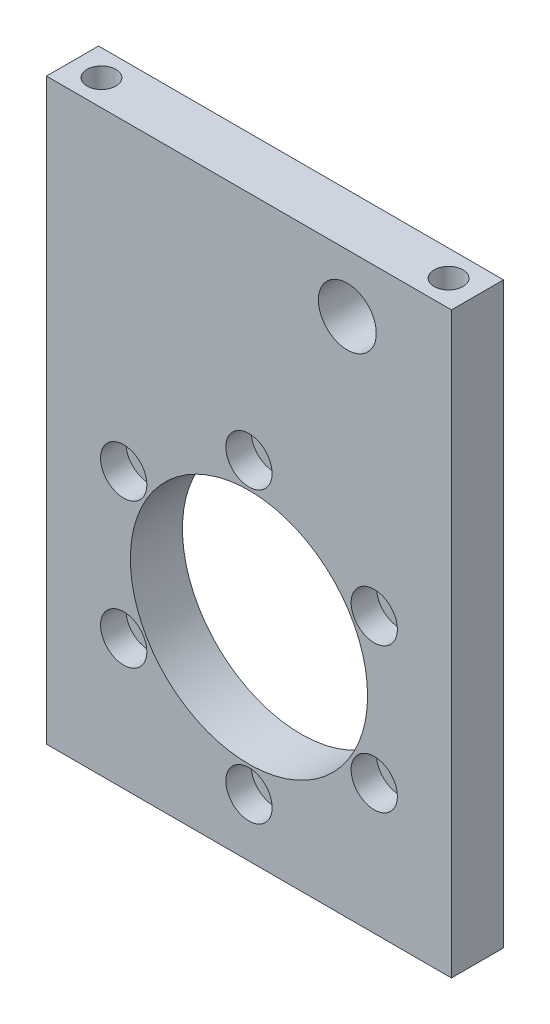
from build123d import *

# Parameters (mm, degrees)
SKETCH1_W                                           = 70
SKETCH1_H                                           = 100
BOSS_EXTRUDE1_DEPTH                                 = 4.5
CUT_EXTRUDE2_DEPTH                                  = 123.148475226
CUT_EXTRUDE2_DEPTH_BACK                             = 123.148475226
SKETCH3_R                                           = 20.5
M6_TAPPED_HOLE1_AT_2_COUNT                          = 2
M6_TAPPED_HOLE1_AT_2_PITCH                          = 60
CBORE_FOR_M4_HEX_SOCKET_HEAD_CAP_SCREW1_D           = 4.3
CBORE_FOR_M4_HEX_SOCKET_HEAD_CAP_SCREW1_CBORE_D     = 8
CBORE_FOR_M4_HEX_SOCKET_HEAD_CAP_SCREW1_CBORE_DEPTH = 4.4
CIRPATTERN1_COUNT                                   = 6
SKETCH8_R                                           = 5
CUT_EXTRUDE3_DEPTH                                  = 10


with BuildPart() as part:
    # Sketch1 → Boss-Extrude1 (new, symmetric)
    with BuildSketch(Plane.XY):
        with Locations((35, 50)):
            Rectangle(SKETCH1_W, SKETCH1_H)
    extrude(amount=BOSS_EXTRUDE1_DEPTH, both=True)

    # Sketch3 → Cut-Extrude2 (cut, two sides: drawn at the far end of the back side and taken through both)
    with BuildSketch(Plane.XY.offset(-CUT_EXTRUDE2_DEPTH_BACK)):
        with Locations((35, 35)):
            Circle(SKETCH3_R)
    extrude(amount=CUT_EXTRUDE2_DEPTH + CUT_EXTRUDE2_DEPTH_BACK, mode=Mode.SUBTRACT)

    # Sketch5 → M6 Tapped Hole1 (revolve, cut)
    with BuildSketch(Plane(origin=(65, 0, 0), x_dir=(0, 0, -1), z_dir=(1, 0, 0))):
        Polygon((0, 0), (0, 16.502151548), (2.5, 15), (2.5, 0), align=None)
    m6_tapped_hole1 = revolve(axis=Axis((65, -6.35, 0), (0, 1, 0)), mode=Mode.SUBTRACT)

    # M6 Tapped Hole1 at 2: M6 Tapped Hole1 ×2
    with Locations(*[(-i * M6_TAPPED_HOLE1_AT_2_PITCH, 0, 0) for i in range(1, M6_TAPPED_HOLE1_AT_2_COUNT)]):
        add(m6_tapped_hole1, mode=Mode.SUBTRACT)

    # Mirror1: M6 Tapped Hole1 across plane
    add(m6_tapped_hole1.mirror(Plane.ZX.offset(50)), mode=Mode.SUBTRACT)

    # Mirror1 copy 1 sketch → Mirror1 copy 1 (revolve, cut)
    with BuildSketch(Plane(origin=(5, 100, 0), x_dir=(0, 0, -1), z_dir=(1, 0, 0))):
        Polygon((0, 0), (0, -16.502151548), (2.5, -15), (2.5, 0), align=None)
    revolve(axis=Axis((5, 106.35, 0), (0, 1, 0)), mode=Mode.SUBTRACT)

    # CBORE for M4 Hex Socket Head Cap Screw1 (through all)
    with Locations(Plane.XY.offset(4.5)):
        with Locations((35, 60)):
            cbore_for_m4_hex_socket_head_cap_screw1 = CounterBoreHole(CBORE_FOR_M4_HEX_SOCKET_HEAD_CAP_SCREW1_D / 2, CBORE_FOR_M4_HEX_SOCKET_HEAD_CAP_SCREW1_CBORE_D / 2, CBORE_FOR_M4_HEX_SOCKET_HEAD_CAP_SCREW1_CBORE_DEPTH)

    # CirPattern1: CBORE for M4 Hex Socket Head Cap Screw1 ×6 about axis
    cirpattern1_axis = Axis((35, 35, -4.5), (0, 0, 1))
    for i in range(1, CIRPATTERN1_COUNT):
        add(cbore_for_m4_hex_socket_head_cap_screw1.rotate(cirpattern1_axis, i * 360 / CIRPATTERN1_COUNT), mode=Mode.SUBTRACT)

    # Sketch8 → Cut-Extrude3 (cut)
    with BuildSketch(Plane.XY.offset(4.5)):
        with Locations((52, 90)):
            Circle(SKETCH8_R)
    extrude(amount=-CUT_EXTRUDE3_DEPTH, mode=Mode.SUBTRACT)


solid = part.part
